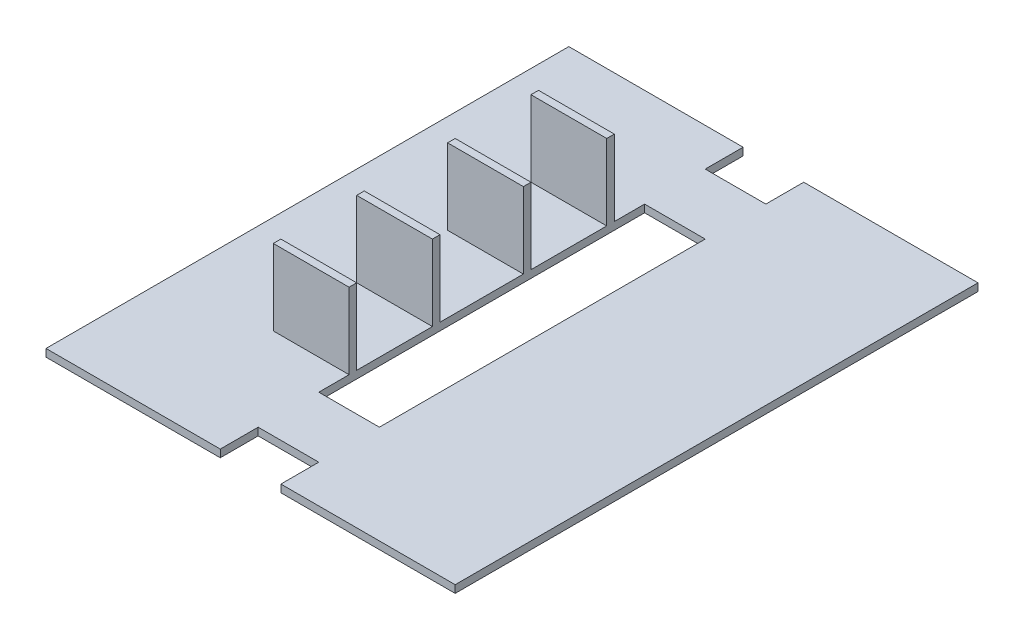
from build123d import *

# Parameters (mm, degrees)
SKETCH1_W           = 40
SKETCH1_H           = 215
BOSS_EXTRUDE1_DEPTH = 5
SKETCH2_W           = 50
SKETCH2_H           = 5
BOSS_EXTRUDE2_DEPTH = 50


with BuildPart() as part:
    # Sketch1 → Boss-Extrude1 (new body)
    with BuildSketch(Plane(origin=(0, 0, 0), x_dir=(1, 0, 0), z_dir=(0, 1, 0))):
        Polygon((115, 320), (115, 345), (0, 345), (0, 0), (115, 0), (115, 25), (155, 25), (155, 0), (270, 0), (270, 345), (155, 345), (155, 320), align=None)
        with Locations((135, 172.5)):
            Rectangle(SKETCH1_W, SKETCH1_H, mode=Mode.SUBTRACT)
    extrude(amount=BOSS_EXTRUDE1_DEPTH)

    # Sketch2 → Boss-Extrude2 (add)
    with BuildSketch(Plane(origin=(0, 5, 0), x_dir=(1, 0, 0), z_dir=(0, 1, 0))):
        with Locations((90, 257.5)):
            Rectangle(SKETCH2_W, SKETCH2_H)
        with Locations((90, 202.5)):
            Rectangle(SKETCH2_W, SKETCH2_H)
        with Locations((90, 142.5)):
            Rectangle(SKETCH2_W, SKETCH2_H)
        with Locations((90, 87.5)):
            Rectangle(SKETCH2_W, SKETCH2_H)
    extrude(amount=BOSS_EXTRUDE2_DEPTH)


solid = part.part
